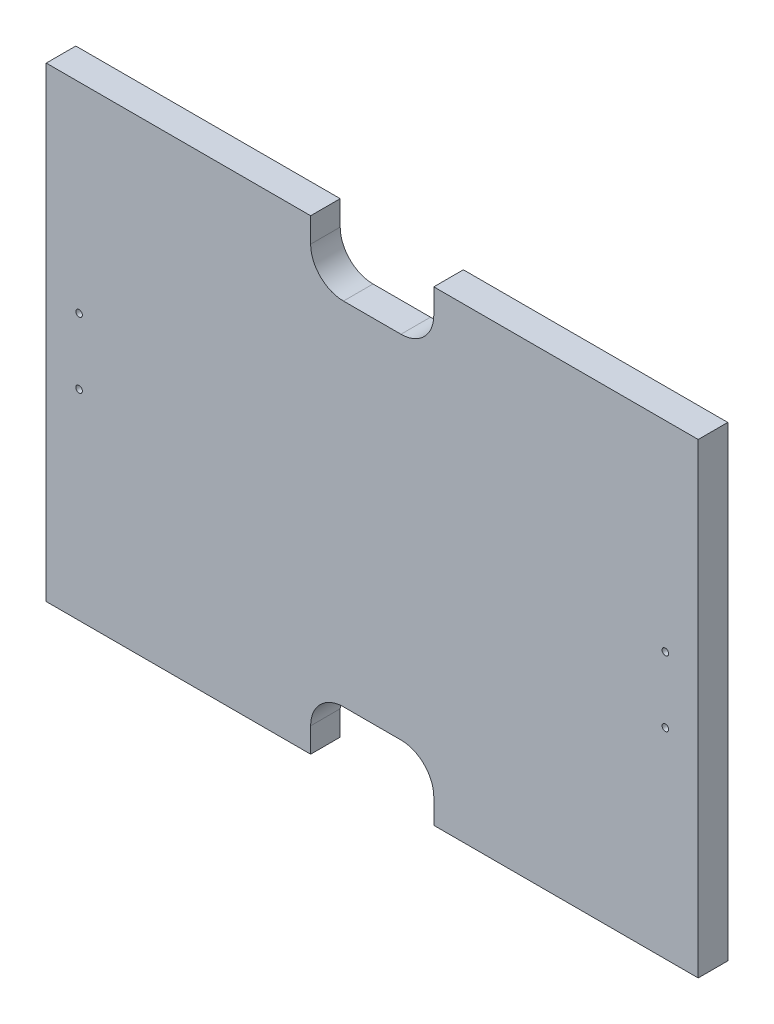
from build123d import *

# Parameters (mm, degrees)
SKETCH1_W           = 397
SKETCH1_H           = 284
BOSS_EXTRUDE1_DEPTH = 18
SKETCH2_R           = 2
CUT_EXTRUDE1_DEPTH  = 489.455729826


with BuildPart() as part:
    # Sketch1 → Boss-Extrude1 (new body)
    with BuildSketch(Plane.XY):
        with Locations((198.5, 142)):
            Rectangle(SKETCH1_W, SKETCH1_H)
    extrude(amount=BOSS_EXTRUDE1_DEPTH)

    # Sketch2 → Cut-Extrude1 (cut, through all)
    with BuildSketch(Plane.XY.offset(18)):
        with Locations((20, 162)):
            Circle(SKETCH2_R)
        with Locations((20, 122)):
            Circle(SKETCH2_R)
        with Locations((377, 122)):
            Circle(SKETCH2_R)
        with Locations((377, 162)):
            Circle(SKETCH2_R)
        with BuildLine():
            Line((236, 284), (161, 284))
            Line((161, 284), (161, 269))
            ThreePointArc((161, 269), (166.857864376, 254.857864376), (181, 249))
            Line((181, 249), (216, 249))
            ThreePointArc((216, 249), (230.142135624, 254.857864376), (236, 269))
            Line((236, 269), (236, 284))
        make_face()
        with BuildLine():
            Line((216, 35), (181, 35))
            ThreePointArc((181, 35), (166.857864376, 29.142135624), (161, 15))
            Line((161, 15), (161, 0))
            Line((161, 0), (236, 0))
            Line((236, 0), (236, 15))
            ThreePointArc((236, 15), (230.142135624, 29.142135624), (216, 35))
        make_face()
    extrude(amount=-CUT_EXTRUDE1_DEPTH, mode=Mode.SUBTRACT)


solid = part.part
